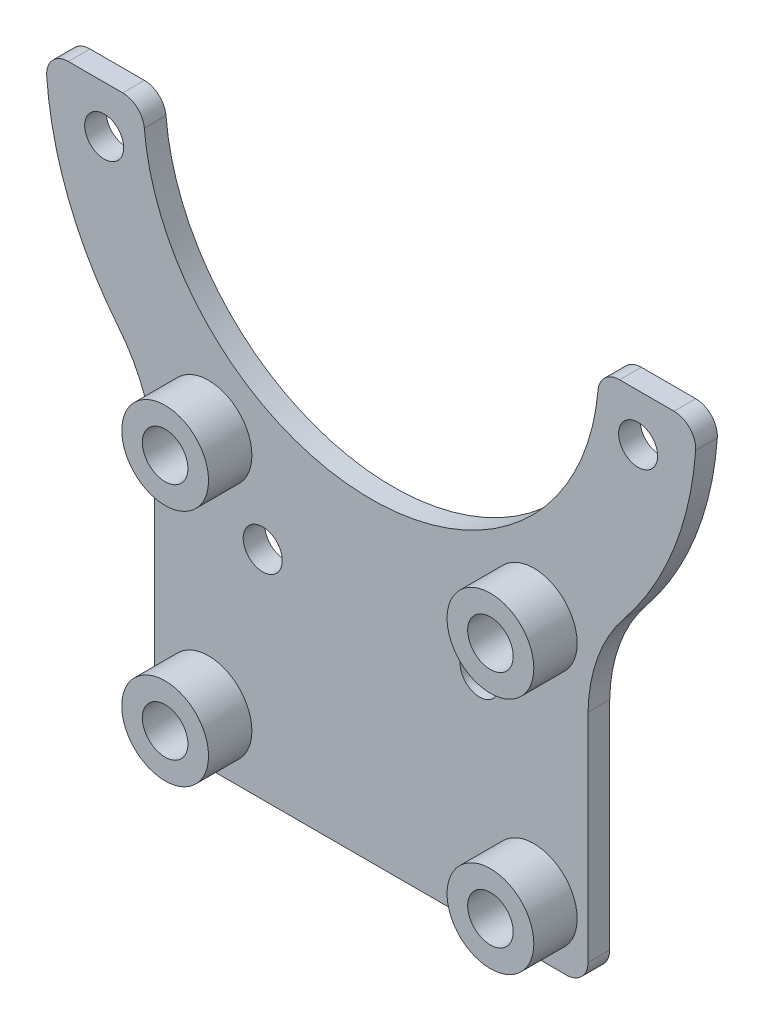
from build123d import *

# Parameters (mm, degrees)
BOSS_EXTRUDE1_DEPTH        = 2
FILLET1_R                  = 15
FILLET3_R                  = 2
M3_CLEARANCE_HOLE1_D       = 3.6
SKETCH7_R                  = 4
BOSS_EXTRUDE2_DEPTH        = 4
F_4_2_4_2_DIAMETER_HOLE1_D = 4.2


with BuildPart() as part:
    # Sketch1 → Boss-Extrude1 (new body)
    with BuildSketch(Plane.XY):
        with BuildLine():
            Line((-10.770329614, -28), (-20, -28))
            Line((-20, -28), (-20, -50))
            Line((-20, -50), (20, -50))
            Line((20, -50), (20, -28))
            Line((20, -28), (10.770329614, -28))
            ThreePointArc((10.770329614, -28), (24.729636961, -16.983670268), (30, 0))
            Line((30, 0), (21, 0))
            ThreePointArc((21, 0), (0, -21), (-21, 0))
            Line((-21, 0), (-30, 0))
            ThreePointArc((-30, 0), (-24.729636961, -16.983670268), (-10.770329614, -28))
        make_face()
    extrude(amount=BOSS_EXTRUDE1_DEPTH)

    # Fillet1
    # the kernel refuses this fillet: 15 mm, written as the material it adds along each edge
    with BuildSketch(Plane(origin=(-10.770329614, -28, 0), x_dir=(-0.8085477056225583, 0.588430631198357, 0), z_dir=(0, 0, 1))) as fillet1_piece_1:
        with BuildLine():
            CenterArc((19.419330938, 14.488463805), FILLET1_R, 217.144663105, 37.84908673)
            Line((7.462628814, 5.431020771), (0, 0))
            ThreePointArc((0, 0), (7.767732375, 1.023072389), (15.53546475, 0))
        make_face()
    extrude(amount=2)
    with BuildSketch(Plane(origin=(10.770329614, -28, 0), x_dir=(0.8085477056225584, 0.5884306311983569, 0), z_dir=(0, 0, 1))) as fillet1_piece_2:
        with BuildLine():
            CenterArc((19.419330938, -14.488463805), FILLET1_R, 105.006250165, 37.84908673)
            Line((7.462628814, -5.431020771), (0, 0))
            ThreePointArc((0, 0), (7.767732375, -1.023072389), (15.53546475, 0))
        make_face()
    extrude(amount=2)

    # Fillet3
    fillet3_edges = [part.edges().sort_by_distance(p)[0] for p in [
        (20, -50, 1),
        (-20, -50, 1),
        (-30, 0, 1),
        (-21, 0, 1),
        (21, 0, 1),
        (30, 0, 1),
    ]]
    fillet(fillet3_edges, radius=FILLET3_R)

    # M3 Clearance Hole1 (through all)
    with Locations(Plane.XY.offset(2)):
        with Locations((10, -30), (-24.620193825, -4.341204442), (-10, -30), (24.620193825, -4.341204442)):
            Hole(M3_CLEARANCE_HOLE1_D / 2)

    # Sketch7 → Boss-Extrude2 (add)
    with BuildSketch(Plane.XY.offset(2)):
        with Locations((-15, -45)):
            Circle(SKETCH7_R)
        with Locations((15, -45)):
            Circle(SKETCH7_R)
        with Locations((15, -23)):
            Circle(SKETCH7_R)
        with Locations((-15, -23)):
            Circle(SKETCH7_R)
    extrude(amount=BOSS_EXTRUDE2_DEPTH)

    # Ø4.2 (4.2) Diameter Hole1 (through all)
    with Locations(Plane.XY.offset(6)):
        with Locations((-15, -23), (15, -23), (15, -45), (-15, -45)):
            Hole(F_4_2_4_2_DIAMETER_HOLE1_D / 2)


solid = part.part
